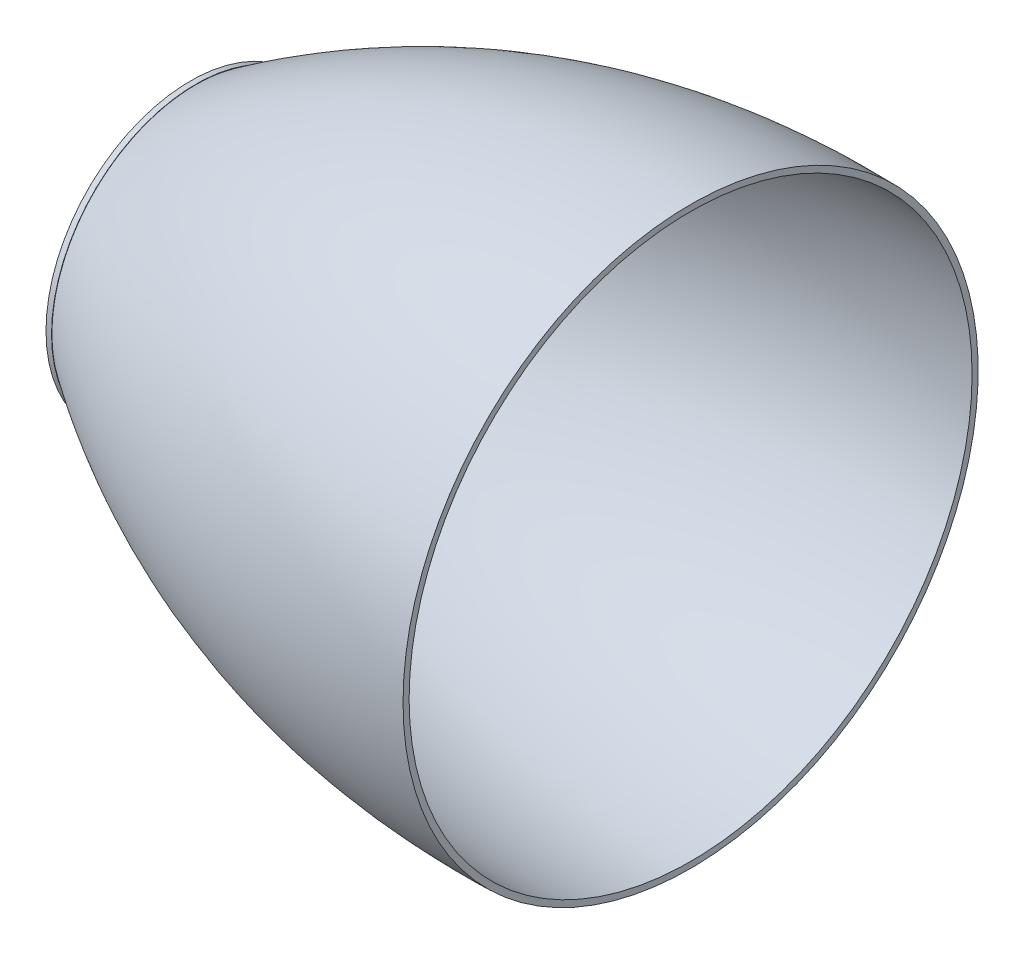
from build123d import *

# Parameters (mm, degrees)
CUT_EXTRUDE1_DEPTH      = 9244.13068636
CUT_EXTRUDE1_DEPTH_BACK = 9244.13068636
SKETCH2_W               = 3460
SKETCH2_H               = 4009.115168684
SKETCH3_R               = 1334.120328739
SKETCH3_R_2             = 1296.020328739
BOSS_EXTRUDE1_DEPTH     = 50.8


with BuildPart() as part:
    # Sketch1 → Revolve1 (revolve)
    with BuildSketch(Plane.XY):
        with BuildLine():
            Line((8080, 3557.926810244), (8080, 3614.097906364))
            add(Edge.make_bspline(
                [(3000, 1915.575812728), (5246.433328547, 3681.825040508), (8080, 3614.097906364)],
                knots=[0, 0, 0, 1, 1, 1], degree=2))
            add(Edge.make_bspline(
                [(0, 2503.157086019), (1544.377938523, 2575.865848039), (3000, 1915.575812728)],
                knots=[0, 0, 0, 1, 1, 1], degree=2))
            Line((0, 2503.157086019), (0, 2429.300878983))
            add(Edge.make_bspline(
                [(3000, 1858.812669889), (1602.932753255, 2555.417060799), (0, 2429.300878983)],
                knots=[0, 0, 0, 1, 1, 1], degree=2))
            add(Edge.make_bspline(
                [(3000, 1858.812669889), (5292.511155726, 3572.53565829), (8080, 3557.926810244)],
                knots=[0, 0, 0, 1, 1, 1], degree=2))
        make_face()
    revolve(axis=Axis((-55.817920771, 957.787906364, 0), (1, 0, 0)))

    # Sketch2 → Cut-Extrude1 (cut, two sides: drawn at the far end of the back side and taken through both)
    with BuildSketch(Plane(origin=(0, 0, 0), x_dir=(1, 0, 0), z_dir=(0, 1, 0)).offset(-CUT_EXTRUDE1_DEPTH_BACK)):
        with Locations((1730, -56.656727838)):
            Rectangle(SKETCH2_W, SKETCH2_H)
    extrude(amount=CUT_EXTRUDE1_DEPTH + CUT_EXTRUDE1_DEPTH_BACK, mode=Mode.SUBTRACT)


with BuildPart() as body_2:
    # Sketch3 → Boss-Extrude1 (new body)
    with BuildSketch(Plane.ZY.offset(-3460)):
        with Locations((0, 957.787906364)):
            Circle(SKETCH3_R)
        with Locations((0, 957.787906364)):
            Circle(SKETCH3_R_2, mode=Mode.SUBTRACT)
    extrude(amount=-BOSS_EXTRUDE1_DEPTH)


solid = Compound([part.part, body_2.part])
